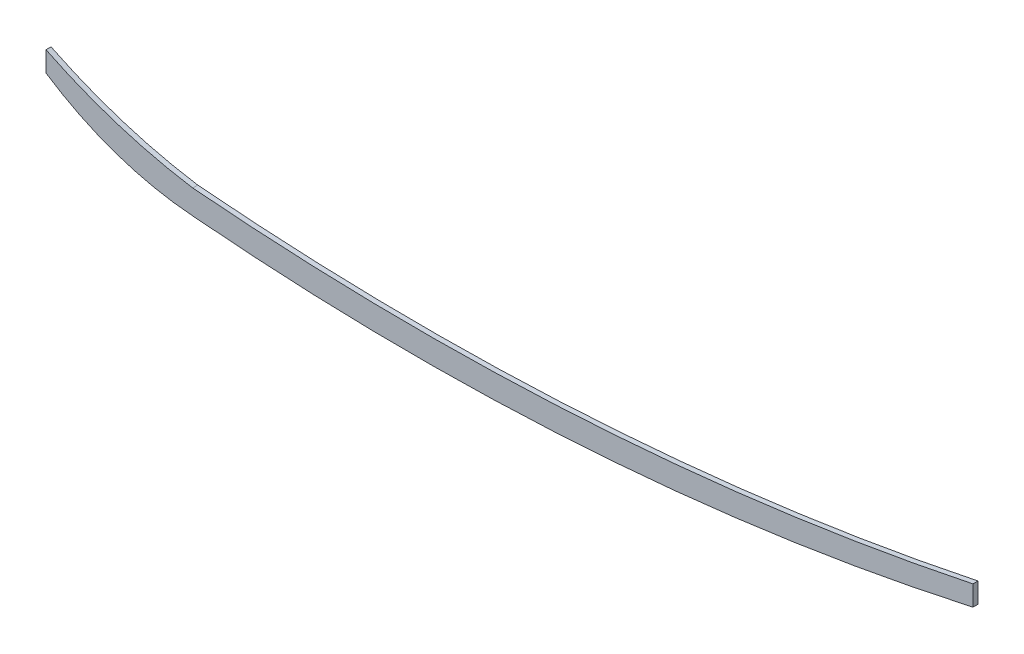
from build123d import *

# Parameters (mm, degrees)
BOSS_EXTRUDE1_DEPTH = 1.5875


with BuildPart() as part:
    # Sketch1 → Boss-Extrude1 (new, symmetric)
    with BuildSketch(Plane.XY):
        with BuildLine():
            Line((0, -84.863004684), (0, -97.563004684))
            ThreePointArc((0, -97.563004684), (44.158404147, -119.360611557), (92.3925, -129.288970912))
            ThreePointArc((92.3925, -129.288970912), (339.198389145, -132.023125314), (583.522463964, -97.003573898))
            Line((583.522463964, -97.003573898), (583.522463964, -84.303573898))
            ThreePointArc((583.522463964, -84.303573898), (339.042339878, -117.088496575), (92.3925, -114.048970912))
            ThreePointArc((92.3925, -114.048970912), (45.091480007, -102.953300884), (0, -84.863004684))
        make_face()
    extrude(amount=BOSS_EXTRUDE1_DEPTH, both=True)


solid = part.part
